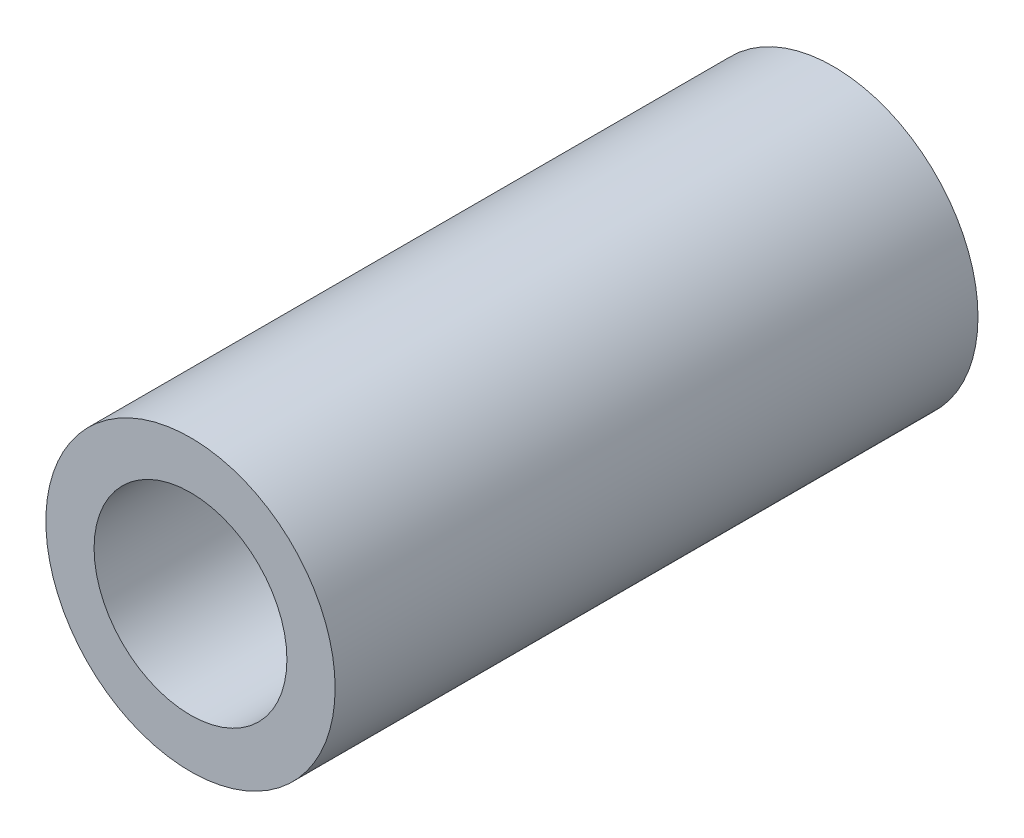
from build123d import *

# Parameters (mm, degrees)
BOSS_EXTRUDE1_DEPTH      = 14
BOSS_EXTRUDE1_DEPTH_BACK = 6
SKETCH1_R                = 4.5
SKETCH2_R                = 3
CUT_EXTRUDE1_DEPTH       = 6


with BuildPart() as part:
    # Sketch1 → Boss-Extrude1 (new, two sides: drawn at the far end of the back side and taken through both)
    with BuildSketch(Plane.XY.offset(-BOSS_EXTRUDE1_DEPTH_BACK)):
        with Locations((0, 43.138377069)):
            Circle(SKETCH1_R)
    extrude(amount=BOSS_EXTRUDE1_DEPTH + BOSS_EXTRUDE1_DEPTH_BACK)

    # Sketch2 → Cut-Extrude1 (cut)
    with BuildSketch(Plane.XY.offset(14)):
        with Locations((0, 43.158036623)):
            Circle(SKETCH2_R)
    extrude(amount=-CUT_EXTRUDE1_DEPTH, mode=Mode.SUBTRACT)


solid = part.part
